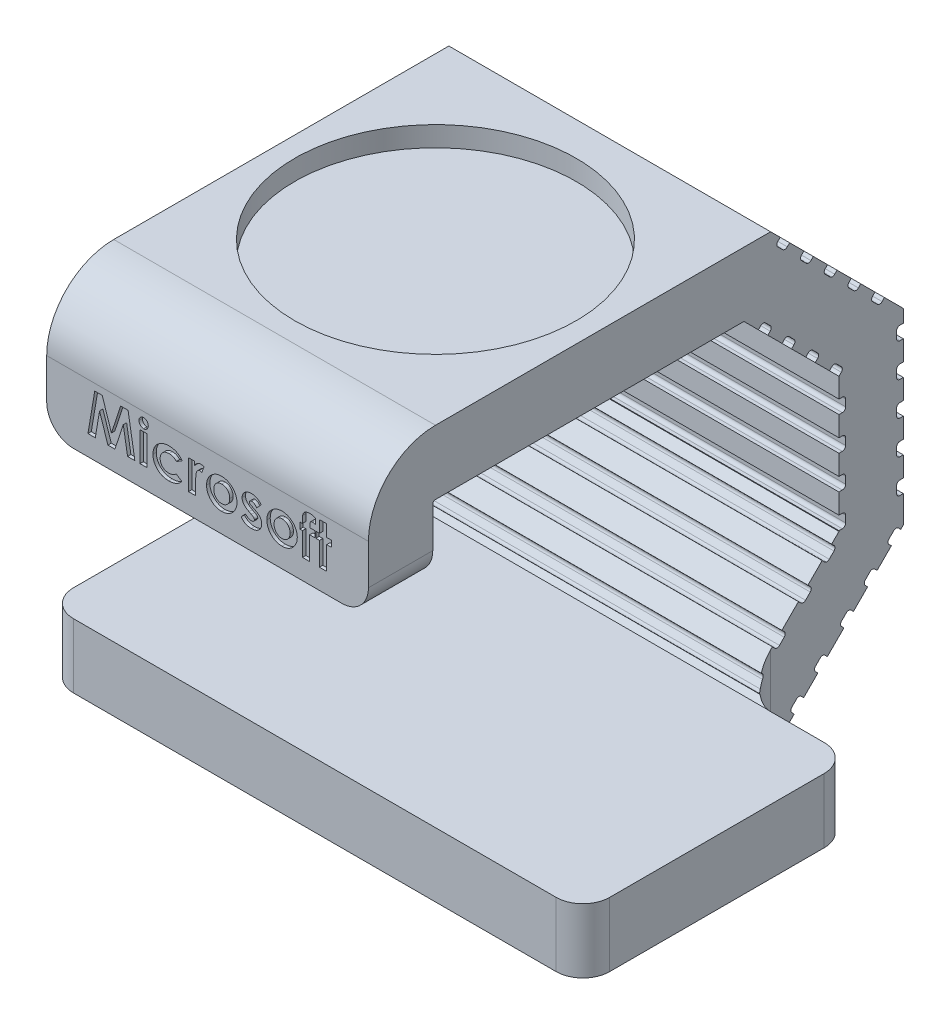
from build123d import *

# Parameters (mm, degrees)
ESTRUSIONE_ESTRUSIONE1_DEPTH  = 24
ESTRUSIONE_ESTRUSIONE2_DEPTH  = 4.8
RACCORDO1_R                   = 2
SCHIZZO3_R                    = 10.5
TAGLIO_ESTRUSIONE1_DEPTH      = 1.5
RACCORDO2_R                   = 2
TAGLIO_ESTRUSIONE2_DEPTH      = 57.426496379
TAGLIO_ESTRUSIONE2_DEPTH_BACK = 57.426496379
AVVOLGI1_START                = -0.25
AVVOLGI1_OUTLINE_W            = 0.538461538
AVVOLGI1_OUTLINE_H            = 2.192307693
AVVOLGI1_DEPTH                = 0.25


# Read off the part's stored shape, not the designer's step: Avvolgi1
with BuildPart() as part:
    # Schizzo1 → Estrusione-Estrusione1 (new body)
    with BuildSketch(Plane(origin=(0, 0, 0), x_dir=(0, 0, -1), z_dir=(1, 0, 0))):
        with BuildLine():
            Line((0, 0), (22, 0))
            Line((22, 0), (31.899494937, 9.899494937))
            Line((31.899494937, 9.899494937), (31.899494937, 23.899494937))
            Line((31.899494937, 23.899494937), (22, 33.798989873))
            Line((22, 33.798989873), (-3, 33.798989873))
            ThreePointArc((-3, 33.798989873), (-6.535533906, 32.334523779), (-8, 28.798989873))
            Line((-8, 28.798989873), (-8, 23.798989873))
            Line((-8, 23.798989873), (-3.2, 23.798989873))
            Line((-3.2, 23.798989873), (-3.2, 28.798989873))
            ThreePointArc((-3.2, 28.798989873), (-3.141421356, 28.940411229), (-3, 28.998989873))
            Line((-3, 28.998989873), (20.011774901, 28.998989873))
            Line((20.011774901, 28.998989873), (27.099494937, 21.911269837))
            Line((27.099494937, 21.911269837), (27.099494937, 11.887720036))
            Line((27.099494937, 11.887720036), (20.011774901, 4.8))
            Line((20.011774901, 4.8), (0, 4.8))
            Line((0, 4.8), (0, 0))
        make_face()
    extrude(amount=ESTRUSIONE_ESTRUSIONE1_DEPTH)

    # Schizzo2 → Estrusione-Estrusione2 (add)
    with BuildSketch(Plane.XZ):
        with BuildLine():
            Line((30, 0), (-6, 0))
            ThreePointArc((-6, 0), (-7.414213562, -0.585786438), (-8, -2))
            Line((-8, -2), (-8, -18))
            ThreePointArc((-8, -18), (-7.414213562, -19.414213562), (-6, -20))
            Line((-6, -20), (30, -20))
            ThreePointArc((30, -20), (31.414213562, -19.414213562), (32, -18))
            Line((32, -18), (32, -2))
            ThreePointArc((32, -2), (31.414213562, -0.585786438), (30, 0))
        make_face()
    extrude(amount=-ESTRUSIONE_ESTRUSIONE2_DEPTH)

    # Raccordo1
    # the kernel refuses this fillet: 2 mm, written as the material it adds along each edge
    with BuildSketch(Plane(origin=(24, 0, -20), x_dir=(0, 0, -1), z_dir=(0, 1, 0))) as raccordo1_piece_1_section:
        with BuildLine():
            CenterArc((RACCORDO1_R, -RACCORDO1_R), RACCORDO1_R, 90, 90)
            Line((0, -RACCORDO1_R), (0, 0))
            Line((0, 0), (RACCORDO1_R, 0))
        make_face()
    raccordo1_piece_1 = extrude(amount=4.8, mode=Mode.PRIVATE)
    raccordo1_piece_1 = split(raccordo1_piece_1, bisect_by=Plane(origin=(24.452498062, 3.819976411, -19.031751312), z_dir=(0, -0.7071067811865431, -0.707106781186552)), keep=Keep.TOP, mode=Mode.PRIVATE)
    add(raccordo1_piece_1)
    with BuildSketch(Plane(origin=(24, 0, -20), x_dir=(0, 0, -1), z_dir=(0, 1, 0))) as raccordo1_piece_2_section:
        with BuildLine():
            CenterArc((RACCORDO1_R, -RACCORDO1_R), RACCORDO1_R, 90, 90)
            Line((0, -RACCORDO1_R), (0, 0))
            Line((0, 0), (RACCORDO1_R, 0))
        make_face()
    raccordo1_piece_2 = extrude(amount=4.8, mode=Mode.PRIVATE)
    raccordo1_piece_2 = split(raccordo1_piece_2, bisect_by=Plane(origin=(24.977199086, 4.77405125, -19.98582615), z_dir=(0, 0.7071067811865431, 0.707106781186552)), keep=Keep.TOP, mode=Mode.PRIVATE)
    add(raccordo1_piece_2)
    with BuildSketch(Plane(origin=(24, 0, -20), x_dir=(0, 0, -1), z_dir=(0, 1, 0))) as raccordo1_piece_3_section:
        with BuildLine():
            CenterArc((RACCORDO1_R, -RACCORDO1_R), RACCORDO1_R, 90, 90)
            Line((0, -RACCORDO1_R), (0, 0))
            Line((0, 0), (RACCORDO1_R, 0))
        make_face()
    raccordo1_piece_3 = extrude(amount=9.8, mode=Mode.PRIVATE)
    raccordo1_piece_3 = split(raccordo1_piece_3, bisect_by=Plane(origin=(24.208417606, 4.8, -20.868927937), z_dir=(0, 1, 0)), keep=Keep.TOP, mode=Mode.PRIVATE)
    raccordo1_piece_3 = split(raccordo1_piece_3, bisect_by=Plane(origin=(24.208417606, 5.442864777, -20.654639678), z_dir=(0, -0.7071067811865431, -0.707106781186552)), keep=Keep.TOP, mode=Mode.PRIVATE)
    add(raccordo1_piece_3)
    with BuildSketch(Plane(origin=(0, 0, -20), x_dir=(-1, 0, 0), z_dir=(0, 1, 0))) as raccordo1_piece_4_section:
        with BuildLine():
            CenterArc((RACCORDO1_R, -RACCORDO1_R), RACCORDO1_R, 90, 90)
            Line((0, -RACCORDO1_R), (0, 0))
            Line((0, 0), (RACCORDO1_R, 0))
        make_face()
    raccordo1_piece_4 = extrude(amount=4.8, mode=Mode.PRIVATE)
    raccordo1_piece_4 = split(raccordo1_piece_4, bisect_by=Plane(origin=(-0.452498062, 3.819976411, -19.031751312), z_dir=(0, -0.7071067811865431, -0.707106781186552)), keep=Keep.TOP, mode=Mode.PRIVATE)
    add(raccordo1_piece_4)
    with BuildSketch(Plane(origin=(0, 0, -20), x_dir=(-1, 0, 0), z_dir=(0, 1, 0))) as raccordo1_piece_5_section:
        with BuildLine():
            CenterArc((RACCORDO1_R, -RACCORDO1_R), RACCORDO1_R, 90, 90)
            Line((0, -RACCORDO1_R), (0, 0))
            Line((0, 0), (RACCORDO1_R, 0))
        make_face()
    raccordo1_piece_5 = extrude(amount=9.8, mode=Mode.PRIVATE)
    raccordo1_piece_5 = split(raccordo1_piece_5, bisect_by=Plane(origin=(-0.208417604, 4.8, -20.868927937), z_dir=(0, 1, 0)), keep=Keep.TOP, mode=Mode.PRIVATE)
    raccordo1_piece_5 = split(raccordo1_piece_5, bisect_by=Plane(origin=(-0.208417604, 5.442864778, -20.654639678), z_dir=(0, -0.7071067811865431, -0.707106781186552)), keep=Keep.TOP, mode=Mode.PRIVATE)
    add(raccordo1_piece_5)
    with BuildSketch(Plane(origin=(0, 0, -20), x_dir=(-1, 0, 0), z_dir=(0, 1, 0))) as raccordo1_piece_6_section:
        with BuildLine():
            CenterArc((RACCORDO1_R, -RACCORDO1_R), RACCORDO1_R, 90, 90)
            Line((0, -RACCORDO1_R), (0, 0))
            Line((0, 0), (RACCORDO1_R, 0))
        make_face()
    raccordo1_piece_6 = extrude(amount=4.8, mode=Mode.PRIVATE)
    raccordo1_piece_6 = split(raccordo1_piece_6, bisect_by=Plane(origin=(-0.977199088, 4.77405125, -19.98582615), z_dir=(0, 0.7071067811865431, 0.707106781186552)), keep=Keep.TOP, mode=Mode.PRIVATE)
    add(raccordo1_piece_6)

    # Schizzo3 → Taglio-Estrusione1 (cut)
    with BuildSketch(Plane(origin=(0, 33.798989873, 0), x_dir=(1, 0, 0), z_dir=(0, 1, 0))):
        with Locations(Location((12, 9, 0), (0, 0, 270))):
            Circle(SCHIZZO3_R)
    extrude(amount=-TAGLIO_ESTRUSIONE1_DEPTH, mode=Mode.SUBTRACT)

    # Raccordo2
    raccordo2_edges = [part.edges().sort_by_distance(p)[0] for p in [
        (0, 23.798989873, 5.6),
        (24, 23.798989873, 5.6),
    ]]
    fillet(raccordo2_edges, radius=RACCORDO2_R)

    # Schizzo4 → Taglio-Estrusione2 (cut, two sides: drawn at the far end of the back side and taken through both)
    with BuildSketch(Plane(origin=(24, 0, 0), x_dir=(0, 0, -1), z_dir=(1, 0, 0)).offset(-TAGLIO_ESTRUSIONE2_DEPTH_BACK)):
        with BuildLine():
            Line((21.072435072, 5.860660172), (20.365328291, 5.153553391))
            Line((20.365328291, 5.153553391), (20.542104986, 4.976776695))
            ThreePointArc((20.542104986, 4.976776695), (20.718881682, 4.903553391), (20.895658377, 4.976776695))
            Line((20.895658377, 4.976776695), (21.249211768, 5.330330086))
            ThreePointArc((21.249211768, 5.330330086), (21.322435072, 5.507106781), (21.249211768, 5.683883476))
            Line((21.249211768, 5.683883476), (21.072435072, 5.860660172))
        make_face()
        with BuildLine():
            Line((26.552512627, 11.340737726), (25.845405845, 10.633630945))
            Line((25.845405845, 10.633630945), (26.022182541, 10.456854249))
            ThreePointArc((26.022182541, 10.456854249), (26.198959236, 10.383630945), (26.375735931, 10.456854249))
            Line((26.375735931, 10.456854249), (26.729289322, 10.81040764))
            ThreePointArc((26.729289322, 10.81040764), (26.802512627, 10.987184335), (26.729289322, 11.163961031))
            Line((26.729289322, 11.163961031), (26.552512627, 11.340737726))
        make_face()
        with BuildLine():
            Line((24.784745674, 9.572970773), (24.077638892, 8.865863992))
            Line((24.077638892, 8.865863992), (24.254415588, 8.689087297))
            ThreePointArc((24.254415588, 8.689087297), (24.431192283, 8.615863992), (24.607968978, 8.689087297))
            Line((24.607968978, 8.689087297), (24.961522369, 9.042640687))
            ThreePointArc((24.961522369, 9.042640687), (25.034745674, 9.219417382), (24.961522369, 9.396194078))
            Line((24.961522369, 9.396194078), (24.784745674, 9.572970773))
        make_face()
        with BuildLine():
            Line((22.840202025, 7.628427125), (22.133095244, 6.921320344))
            Line((22.133095244, 6.921320344), (22.309871939, 6.744543648))
            ThreePointArc((22.309871939, 6.744543648), (22.486648635, 6.671320344), (22.66342533, 6.744543648))
            Line((22.66342533, 6.744543648), (23.016978721, 7.098097039))
            ThreePointArc((23.016978721, 7.098097039), (23.090202025, 7.274873734), (23.016978721, 7.451650429))
            Line((23.016978721, 7.451650429), (22.840202025, 7.628427125))
        make_face()
        with BuildLine():
            Line((24.624621202, 24.386143571), (25.331727984, 23.67903679))
            Line((25.331727984, 23.67903679), (25.508504679, 23.855813485))
            ThreePointArc((25.508504679, 23.855813485), (25.581727984, 24.032590181), (25.508504679, 24.209366876))
            Line((25.508504679, 24.209366876), (25.154951288, 24.562920267))
            ThreePointArc((25.154951288, 24.562920267), (24.978174593, 24.636143571), (24.801397898, 24.562920267))
            Line((24.801397898, 24.562920267), (24.624621202, 24.386143571))
        make_face()
        with BuildLine():
            Line((23.759440841, 1.759440841), (24.466547622, 2.466547622))
            Line((24.466547622, 2.466547622), (24.289770927, 2.643324317))
            ThreePointArc((24.289770927, 2.643324317), (24.112994231, 2.716547622), (23.936217536, 2.643324317))
            Line((23.936217536, 2.643324317), (23.582664146, 2.289770927))
            ThreePointArc((23.582664146, 2.289770927), (23.509440841, 2.112994231), (23.582664146, 1.936217536))
            Line((23.582664146, 1.936217536), (23.759440841, 1.759440841))
        make_face()
        with BuildLine():
            Line((25.527207794, 3.527207794), (26.234314575, 4.234314575))
            Line((26.234314575, 4.234314575), (26.05753788, 4.41109127))
            ThreePointArc((26.05753788, 4.41109127), (25.880761184, 4.484314575), (25.703984489, 4.41109127))
            Line((25.703984489, 4.41109127), (25.350431099, 4.05753788))
            ThreePointArc((25.350431099, 4.05753788), (25.277207794, 3.880761184), (25.350431099, 3.703984489))
            Line((25.350431099, 3.703984489), (25.527207794, 3.527207794))
        make_face()
        with BuildLine():
            ThreePointArc((28.002081528, 6.355634919), (27.825304833, 6.428858223), (27.648528137, 6.355634919))
            Line((27.648528137, 6.355634919), (27.294974747, 6.002081528))
            ThreePointArc((27.294974747, 6.002081528), (27.221751442, 5.825304833), (27.294974747, 5.648528137))
            Line((27.294974747, 5.648528137), (27.471751442, 5.471751442))
            Line((27.471751442, 5.471751442), (28.178858223, 6.178858223))
            Line((28.178858223, 6.178858223), (28.002081528, 6.355634919))
        make_face()
        with BuildLine():
            Line((31.007285348, 9.007285348), (31.714392129, 9.714392129))
            Line((31.714392129, 9.714392129), (31.537615434, 9.891168825))
            ThreePointArc((31.537615434, 9.891168825), (31.360838739, 9.964392129), (31.184062043, 9.891168825))
            Line((31.184062043, 9.891168825), (30.830508653, 9.537615434))
            ThreePointArc((30.830508653, 9.537615434), (30.757285348, 9.360838739), (30.830508653, 9.184062043))
            Line((30.830508653, 9.184062043), (31.007285348, 9.007285348))
        make_face()
        with BuildLine():
            Line((21.991673888, -0.008326112), (22.698780669, 0.698780669))
            Line((22.698780669, 0.698780669), (22.522003974, 0.875557364))
            ThreePointArc((22.522003974, 0.875557364), (22.345227279, 0.948780669), (22.168450583, 0.875557364))
            Line((22.168450583, 0.875557364), (21.814897193, 0.522003974))
            ThreePointArc((21.814897193, 0.522003974), (21.741673888, 0.345227279), (21.814897193, 0.168450583))
            Line((21.814897193, 0.168450583), (21.991673888, -0.008326112))
        make_face()
        with BuildLine():
            Line((29.239518395, 7.239518395), (29.946625176, 7.946625176))
            Line((29.946625176, 7.946625176), (29.769848481, 8.123401872))
            ThreePointArc((29.769848481, 8.123401872), (29.593071786, 8.196625176), (29.41629509, 8.123401872))
            Line((29.41629509, 8.123401872), (29.0627417, 7.769848481))
            ThreePointArc((29.0627417, 7.769848481), (28.989518395, 7.593071786), (29.0627417, 7.41629509))
            Line((29.0627417, 7.41629509), (29.239518395, 7.239518395))
        make_face()
        with BuildLine():
            Line((27.099494937, 12.937720036), (27.099494937, 11.937720036))
            Line((27.099494937, 11.937720036), (27.349494937, 11.937720036))
            ThreePointArc((27.349494937, 11.937720036), (27.526271632, 12.010943341), (27.599494937, 12.187720036))
            Line((27.599494937, 12.187720036), (27.599494937, 12.687720036))
            ThreePointArc((27.599494937, 12.687720036), (27.526271632, 12.864496731), (27.349494937, 12.937720036))
            Line((27.349494937, 12.937720036), (27.099494937, 12.937720036))
        make_face()
        with BuildLine():
            Line((27.349494937, 15.437720036), (27.099494937, 15.437720036))
            Line((27.099494937, 15.437720036), (27.099494937, 14.437720036))
            Line((27.099494937, 14.437720036), (27.349494937, 14.437720036))
            ThreePointArc((27.349494937, 14.437720036), (27.526271632, 14.510943341), (27.599494937, 14.687720036))
            Line((27.599494937, 14.687720036), (27.599494937, 15.187720036))
            ThreePointArc((27.599494937, 15.187720036), (27.526271632, 15.364496731), (27.349494937, 15.437720036))
        make_face()
        with BuildLine():
            Line((27.349494937, 17.937720036), (27.099494937, 17.937720036))
            Line((27.099494937, 17.937720036), (27.099494937, 16.937720036))
            Line((27.099494937, 16.937720036), (27.349494937, 16.937720036))
            ThreePointArc((27.349494937, 16.937720036), (27.526271632, 17.010943341), (27.599494937, 17.187720036))
            Line((27.599494937, 17.187720036), (27.599494937, 17.687720036))
            ThreePointArc((27.599494937, 17.687720036), (27.526271632, 17.864496731), (27.349494937, 17.937720036))
        make_face()
        with BuildLine():
            Line((27.349494937, 20.437720036), (27.099494937, 20.437720036))
            Line((27.099494937, 20.437720036), (27.099494937, 19.437720036))
            Line((27.099494937, 19.437720036), (27.349494937, 19.437720036))
            ThreePointArc((27.349494937, 19.437720036), (27.526271632, 19.510943341), (27.599494937, 19.687720036))
            Line((27.599494937, 19.687720036), (27.599494937, 20.187720036))
            ThreePointArc((27.599494937, 20.187720036), (27.526271632, 20.364496731), (27.349494937, 20.437720036))
        make_face()
        with BuildLine():
            Line((31.649494937, 19.437720036), (31.899494937, 19.437720036))
            Line((31.899494937, 19.437720036), (31.899494937, 20.437720036))
            Line((31.899494937, 20.437720036), (31.649494937, 20.437720036))
            ThreePointArc((31.649494937, 20.437720036), (31.472718241, 20.364496731), (31.399494937, 20.187720036))
            Line((31.399494937, 20.187720036), (31.399494937, 19.687720036))
            ThreePointArc((31.399494937, 19.687720036), (31.472718241, 19.510943341), (31.649494937, 19.437720036))
        make_face()
        with BuildLine():
            Line((31.649494937, 16.937720036), (31.899494937, 16.937720036))
            Line((31.899494937, 16.937720036), (31.899494937, 17.937720036))
            Line((31.899494937, 17.937720036), (31.649494937, 17.937720036))
            ThreePointArc((31.649494937, 17.937720036), (31.472718241, 17.864496731), (31.399494937, 17.687720036))
            Line((31.399494937, 17.687720036), (31.399494937, 17.187720036))
            ThreePointArc((31.399494937, 17.187720036), (31.472718241, 17.010943341), (31.649494937, 16.937720036))
        make_face()
        with BuildLine():
            Line((31.649494937, 14.437720036), (31.899494937, 14.437720036))
            Line((31.899494937, 14.437720036), (31.899494937, 15.437720036))
            Line((31.899494937, 15.437720036), (31.649494937, 15.437720036))
            ThreePointArc((31.649494937, 15.437720036), (31.472718241, 15.364496731), (31.399494937, 15.187720036))
            Line((31.399494937, 15.187720036), (31.399494937, 14.687720036))
            ThreePointArc((31.399494937, 14.687720036), (31.472718241, 14.510943341), (31.649494937, 14.437720036))
        make_face()
        with BuildLine():
            Line((26.392388155, 22.618376618), (27.099494937, 21.911269837))
            Line((27.099494937, 21.911269837), (27.276271632, 22.088046533))
            ThreePointArc((27.276271632, 22.088046533), (27.349494937, 22.264823228), (27.276271632, 22.441599923))
            Line((27.276271632, 22.441599923), (26.922718241, 22.795153314))
            ThreePointArc((26.922718241, 22.795153314), (26.745941546, 22.868376618), (26.569164851, 22.795153314))
            Line((26.569164851, 22.795153314), (26.392388155, 22.618376618))
        make_face()
        with BuildLine():
            Line((31.899494937, 11.937720036), (31.899494937, 12.937720036))
            Line((31.899494937, 12.937720036), (31.649494937, 12.937720036))
            ThreePointArc((31.649494937, 12.937720036), (31.472718241, 12.864496731), (31.399494937, 12.687720036))
            Line((31.399494937, 12.687720036), (31.399494937, 12.187720036))
            ThreePointArc((31.399494937, 12.187720036), (31.472718241, 12.010943341), (31.649494937, 11.937720036))
            Line((31.649494937, 11.937720036), (31.899494937, 11.937720036))
        make_face()
        with BuildLine():
            Line((22.856854249, 26.153910524), (23.563961031, 25.446803743))
            Line((23.563961031, 25.446803743), (23.740737726, 25.623580438))
            ThreePointArc((23.740737726, 25.623580438), (23.813961031, 25.800357134), (23.740737726, 25.977133829))
            Line((23.740737726, 25.977133829), (23.387184335, 26.33068722))
            ThreePointArc((23.387184335, 26.33068722), (23.21040764, 26.403910524), (23.033630945, 26.33068722))
            Line((23.033630945, 26.33068722), (22.856854249, 26.153910524))
        make_face()
        with BuildLine():
            Line((21.089087297, 27.921677477), (21.796194078, 27.214570696))
            Line((21.796194078, 27.214570696), (21.972970773, 27.391347391))
            ThreePointArc((21.972970773, 27.391347391), (22.046194078, 27.568124087), (21.972970773, 27.744900782))
            Line((21.972970773, 27.744900782), (21.619417382, 28.098454173))
            ThreePointArc((21.619417382, 28.098454173), (21.442640687, 28.171677477), (21.265863992, 28.098454173))
            Line((21.265863992, 28.098454173), (21.089087297, 27.921677477))
        make_face()
        with BuildLine():
            Line((31.649494937, 21.937720036), (31.899494937, 21.937720036))
            Line((31.899494937, 21.937720036), (31.899494937, 22.937720036))
            Line((31.899494937, 22.937720036), (31.649494937, 22.937720036))
            ThreePointArc((31.649494937, 22.937720036), (31.472718241, 22.864496731), (31.399494937, 22.687720036))
            Line((31.399494937, 22.687720036), (31.399494937, 22.187720036))
            ThreePointArc((31.399494937, 22.187720036), (31.472718241, 22.010943341), (31.649494937, 21.937720036))
        make_face()
        with BuildLine():
            Line((25.190306627, 30.608683246), (24.483199846, 31.315790027))
            Line((24.483199846, 31.315790027), (24.306423151, 31.139013332))
            ThreePointArc((24.306423151, 31.139013332), (24.233199846, 30.962236636), (24.306423151, 30.785459941))
            Line((24.306423151, 30.785459941), (24.659976542, 30.431906551))
            ThreePointArc((24.659976542, 30.431906551), (24.836753237, 30.358683246), (25.013529932, 30.431906551))
            Line((25.013529932, 30.431906551), (25.190306627, 30.608683246))
        make_face()
        with BuildLine():
            Line((26.95807358, 28.840916293), (26.250966799, 29.548023074))
            Line((26.250966799, 29.548023074), (26.074190104, 29.371246379))
            ThreePointArc((26.074190104, 29.371246379), (26.000966799, 29.194469683), (26.074190104, 29.017692988))
            Line((26.074190104, 29.017692988), (26.427743494, 28.664139598))
            ThreePointArc((26.427743494, 28.664139598), (26.60452019, 28.590916293), (26.781296885, 28.664139598))
            Line((26.781296885, 28.664139598), (26.95807358, 28.840916293))
        make_face()
        with BuildLine():
            Line((30.493607486, 25.305382387), (29.786500705, 26.012489168))
            Line((29.786500705, 26.012489168), (29.60972401, 25.835712473))
            ThreePointArc((29.60972401, 25.835712473), (29.536500705, 25.658935778), (29.60972401, 25.482159082))
            Line((29.60972401, 25.482159082), (29.9632774, 25.128605692))
            ThreePointArc((29.9632774, 25.128605692), (30.140054096, 25.055382387), (30.316830791, 25.128605692))
            Line((30.316830791, 25.128605692), (30.493607486, 25.305382387))
        make_face()
        with BuildLine():
            Line((28.725840533, 27.07314934), (28.018733752, 27.780256121))
            Line((28.018733752, 27.780256121), (27.841957057, 27.603479426))
            ThreePointArc((27.841957057, 27.603479426), (27.768733752, 27.42670273), (27.841957057, 27.249926035))
            Line((27.841957057, 27.249926035), (28.195510447, 26.896372645))
            ThreePointArc((28.195510447, 26.896372645), (28.372287143, 26.82314934), (28.549063838, 26.896372645))
            Line((28.549063838, 26.896372645), (28.725840533, 27.07314934))
        make_face()
        with BuildLine():
            Line((23.422539674, 32.376450199), (22.715432893, 33.08355698))
            Line((22.715432893, 33.08355698), (22.538656198, 32.906780285))
            ThreePointArc((22.538656198, 32.906780285), (22.465432893, 32.730003589), (22.538656198, 32.553226894))
            Line((22.538656198, 32.553226894), (22.892209589, 32.199673503))
            ThreePointArc((22.892209589, 32.199673503), (23.068986284, 32.126450199), (23.245762979, 32.199673503))
            Line((23.245762979, 32.199673503), (23.422539674, 32.376450199))
        make_face()
    extrude(amount=TAGLIO_ESTRUSIONE2_DEPTH + TAGLIO_ESTRUSIONE2_DEPTH_BACK, mode=Mode.SUBTRACT)

    # Avvolgi1 outline → Avvolgi1 (cut)
    # profile 1 of 10: a face of its own
    with BuildSketch(Plane.XY.offset(8).offset(AVVOLGI1_START)):
        with BuildLine():
            add(Edge.make_bspline(
                [(7.576923077, 28.047186989), (7.575639697, 28.022822853), (7.573138971, 27.975348176), (7.553805601, 27.906771391), (7.521496365, 27.844055857), (7.477083774, 27.788843312), (7.424687713, 27.742667572), (7.366077689, 27.707840468), (7.30141733, 27.687258213), (7.256553914, 27.684835444), (7.233774038, 27.683605258)],
                knots=[0, 0, 0, 0, 0.13162057, 0.256468948, 0.381954886, 0.51070434, 0.637377053, 0.757775202, 0.877007784, 1, 1, 1, 1], degree=3))
            add(Edge.make_bspline(
                [(7.229567308, 28.414374489), (7.252774996, 28.413235832), (7.298345529, 28.410999969), (7.363631517, 28.38920528), (7.423550824, 28.354999168), (7.476521153, 28.308067566), (7.520576919, 28.25202265), (7.554237161, 28.18927664), (7.572987879, 28.119756082), (7.575592076, 28.071732007), (7.576923077, 28.047186989)],
                knots=[0, 0, 0, 0, 0.123733577, 0.242962799, 0.363854564, 0.490606197, 0.618739544, 0.743300131, 0.868801156, 1, 1, 1, 1], degree=3))
            add(Edge.make_bspline(
                [(6.884615385, 28.054999489), (6.885948473, 28.078949906), (6.888567134, 28.125997044), (6.907430171, 28.193971957), (6.940318584, 28.255663108), (6.984057013, 28.31068207), (7.036562083, 28.35673822), (7.09644542, 28.389905471), (7.161292032, 28.410799977), (7.206573891, 28.413170682), (7.229567308, 28.414374489)],
                knots=[0, 0, 0, 0, 0.129827096, 0.255026588, 0.378937478, 0.506522648, 0.634371171, 0.754975888, 0.875580604, 1, 1, 1, 1], degree=3))
            add(Edge.make_bspline(
                [(7.233774038, 27.683605258), (7.210363766, 27.684739844), (7.164396772, 27.68696765), (7.098575303, 27.708813333), (7.037856827, 27.74275005), (6.985116283, 27.790640537), (6.94055598, 27.847083695), (6.908366031, 27.911290486), (6.888230421, 27.981286425), (6.885840342, 28.030021768), (6.884615385, 28.054999489)],
                knots=[0, 0, 0, 0, 0.123633166, 0.242758603, 0.363442651, 0.489711254, 0.617482185, 0.742279995, 0.867913967, 1, 1, 1, 1], degree=3))
        make_face()
    # profile 2 of 10: a face of its own
    with BuildSketch(Plane.XY.offset(8).offset(AVVOLGI1_START)):
        with BuildLine():
            add(Edge.make_bspline(
                [(9.669471154, 26.798989873), (9.649032106, 26.819457779), (9.609743117, 26.858802239), (9.546740067, 26.908606084), (9.484862798, 26.949842283), (9.421560367, 26.980272479), (9.356266925, 27.003189333), (9.286627418, 27.018367669), (9.21182903, 27.028362064), (9.160090899, 27.029283823), (9.133413462, 27.029759104)],
                knots=[0, 0, 0, 0, 0.143845607, 0.27650742, 0.399013508, 0.513165303, 0.625101201, 0.742650755, 0.867304473, 1, 1, 1, 1], degree=3))
            Line((9.669471154, 26.798989873), (10.115384615, 27.044182181))
            add(Edge.make_bspline(
                [(9.131009615, 27.529759104), (9.15726271, 27.52946229), (9.209039365, 27.528876911), (9.285501779, 27.522755959), (9.359878454, 27.512359252), (9.432295966, 27.498604847), (9.502974244, 27.481560744), (9.570966013, 27.458841526), (9.637200834, 27.433056069), (9.722511984, 27.394122721), (9.823078215, 27.336008397), (9.933472993, 27.252659646), (10.031903302, 27.155153764), (10.087409607, 27.081369317), (10.115384615, 27.044182181)],
                knots=[0, 0, 0, 0, 0.068894834, 0.135875182, 0.201160501, 0.265918632, 0.329296018, 0.391812639, 0.453909987, 0.515786581, 0.637804213, 0.757893318, 0.87797897, 1, 1, 1, 1], degree=3))
            add(Edge.make_bspline(
                [(7.923076923, 26.387331219), (7.923523306, 26.413190744), (7.924407455, 26.464410511), (7.931955285, 26.540477577), (7.943697171, 26.615253815), (7.961343841, 26.688214336), (7.98304613, 26.759713116), (8.009428201, 26.829735785), (8.04153066, 26.897921012), (8.07734105, 26.964848823), (8.118154922, 27.028752422), (8.162682009, 27.089603605), (8.210859578, 27.147029687), (8.263253592, 27.200495472), (8.319498728, 27.250383529), (8.378777326, 27.297705995), (8.443007614, 27.340022341), (8.509956698, 27.379807523), (8.580201276, 27.415223997), (8.652933983, 27.445793083), (8.727592757, 27.471765931), (8.804356551, 27.492648625), (8.88289588, 27.509859793), (8.963909605, 27.520782708), (9.046727473, 27.52846019), (9.102746191, 27.529323522), (9.131009615, 27.529759104)],
                knots=[0, 0, 0, 0, 0.041780147, 0.082753626, 0.123413874, 0.164008346, 0.203945665, 0.244108014, 0.284805616, 0.325652295, 0.366693494, 0.407225963, 0.447431342, 0.487721344, 0.528073722, 0.568874194, 0.610175022, 0.65225882, 0.694677458, 0.737184942, 0.779671465, 0.822316784, 0.865682179, 0.909494751, 0.954336902, 1, 1, 1, 1], degree=3))
            add(Edge.make_bspline(
                [(9.114783654, 25.260528335), (9.069467399, 25.261575912), (8.980959756, 25.263621946), (8.851962065, 25.279290707), (8.730633039, 25.305682602), (8.616723085, 25.342335519), (8.510336055, 25.389814771), (8.411816972, 25.448706785), (8.320501327, 25.517373398), (8.238036821, 25.59613899), (8.164459559, 25.681876186), (8.100226345, 25.772171086), (8.044674523, 25.865405867), (8.001094173, 25.963132387), (7.965477016, 26.063827412), (7.941422306, 26.168694607), (7.925556743, 26.276870168), (7.923910183, 26.350214512), (7.923076923, 26.387331219)],
                knots=[0, 0, 0, 0, 0.073961065, 0.144454116, 0.211737939, 0.276369484, 0.339453786, 0.401479123, 0.463348243, 0.525568944, 0.587248521, 0.647499501, 0.706274444, 0.764080805, 0.821889941, 0.880346551, 0.939448064, 1, 1, 1, 1], degree=3))
            add(Edge.make_bspline(
                [(10.076923077, 25.70403795), (10.047930663, 25.668591058), (9.990716338, 25.598639311), (9.890893208, 25.508474063), (9.783453368, 25.43100208), (9.666235972, 25.369164925), (9.540948094, 25.319981374), (9.406610727, 25.285213486), (9.263451095, 25.264747112), (9.165131579, 25.261957072), (9.114783654, 25.260528335)],
                knots=[0, 0, 0, 0, 0.124734545, 0.246154138, 0.365612315, 0.485126693, 0.606563492, 0.731916229, 0.862718389, 1, 1, 1, 1], degree=3))
            Line((10.076923077, 25.70403795), (9.658653846, 25.991297566))
            add(Edge.make_bspline(
                [(9.103966346, 25.760528335), (9.132846774, 25.761189203), (9.189217172, 25.762479123), (9.271163372, 25.773419806), (9.348273624, 25.791511848), (9.420556107, 25.816552672), (9.487909696, 25.849294015), (9.55016133, 25.889285124), (9.607950955, 25.936230988), (9.641650681, 25.972831042), (9.658653846, 25.991297566)],
                knots=[0, 0, 0, 0, 0.139546672, 0.272374826, 0.398724725, 0.521823788, 0.641340891, 0.759786424, 0.878800461, 1, 1, 1, 1], degree=3))
            add(Edge.make_bspline(
                [(8.461538462, 26.384326412), (8.462189246, 26.361868682), (8.463459948, 26.318018373), (8.471266716, 26.25359182), (8.484819558, 26.192260491), (8.505140271, 26.134348626), (8.529496917, 26.079322361), (8.560084406, 26.02761933), (8.596053608, 25.979013758), (8.637593885, 25.933928101), (8.683609972, 25.893379083), (8.733218921, 25.857570103), (8.786272721, 25.827210712), (8.843389394, 25.803385413), (8.903637711, 25.783972779), (8.967420013, 25.770150224), (9.034668425, 25.76247775), (9.080509965, 25.761188185), (9.103966346, 25.760528335)],
                knots=[0, 0, 0, 0, 0.066909768, 0.130646062, 0.193049546, 0.253634274, 0.313202194, 0.372057276, 0.432217215, 0.493039582, 0.554348992, 0.614639045, 0.675044192, 0.736012789, 0.79867544, 0.86340984, 0.930109003, 1, 1, 1, 1], degree=3))
            add(Edge.make_bspline(
                [(9.133413462, 27.029759104), (9.10894841, 27.029168183), (9.061072356, 27.028011799), (8.991117843, 27.019374408), (8.924633247, 27.005808361), (8.861737911, 26.985961185), (8.802543858, 26.959741986), (8.74656158, 26.928715509), (8.694335075, 26.891669899), (8.646602581, 26.849131753), (8.603515616, 26.802298196), (8.565079844, 26.752348195), (8.53359187, 26.698540753), (8.506368564, 26.642140541), (8.486353657, 26.582088235), (8.471710265, 26.518928749), (8.463363667, 26.452659285), (8.462154393, 26.407385919), (8.461538462, 26.384326412)],
                knots=[0, 0, 0, 0, 0.070110342, 0.137200061, 0.201727185, 0.264377395, 0.325826769, 0.387007287, 0.447548571, 0.508965744, 0.569916802, 0.629748696, 0.689226879, 0.748301815, 0.808949201, 0.870234712, 0.933905432, 1, 1, 1, 1], degree=3))
        make_face()
    # profile 3 of 10: a face of its own
    with BuildSketch(Plane.XY.offset(8).offset(AVVOLGI1_START)):
        with BuildLine():
            add(Edge.make_bspline(
                [(11.038461538, 27.221465835), (11.051517576, 27.245445855), (11.077036142, 27.292315799), (11.123915888, 27.355229417), (11.177773239, 27.408213512), (11.236672933, 27.452376292), (11.300793485, 27.486796843), (11.368417861, 27.511325825), (11.438967533, 27.527266264), (11.487094128, 27.528922174), (11.511418269, 27.529759104)],
                knots=[0, 0, 0, 0, 0.137332659, 0.268422379, 0.39320538, 0.516430377, 0.637792883, 0.758061252, 0.877719333, 1, 1, 1, 1], degree=3))
            Line((11.038461538, 27.221465835), (11.038461538, 27.491297566))
            Line((11.038461538, 27.491297566), (10.576923077, 27.491297566))
            Line((10.576923077, 27.491297566), (10.576923077, 25.298989873))
            Line((10.576923077, 25.298989873), (11.115384615, 25.298989873))
            Line((11.115384615, 25.298989873), (11.115384615, 26.186610066))
            Line((11.115384615, 26.186610066), (11.113581731, 26.293581219))
            add(Edge.make_bspline(
                [(11.408653846, 27.068220642), (11.398396603, 27.067773308), (11.378218838, 27.066893323), (11.348437021, 27.059352156), (11.320388752, 27.046347647), (11.292722385, 27.02968758), (11.26762049, 27.006528841), (11.2425341, 26.979718488), (11.22042663, 26.946617542), (11.197096838, 26.909774508), (11.177232354, 26.864678668), (11.160199171, 26.810843527), (11.145022468, 26.747646177), (11.134578824, 26.674751071), (11.124484623, 26.592863594), (11.118476307, 26.501382702), (11.113998232, 26.400597668), (11.113724428, 26.330246076), (11.113581731, 26.293581219)],
                knots=[0, 0, 0, 0, 0.034014511, 0.066912404, 0.101140702, 0.136380892, 0.173597996, 0.214075626, 0.25797978, 0.305417223, 0.358684712, 0.420923911, 0.492691001, 0.574130849, 0.665182153, 0.766512664, 0.878314341, 1, 1, 1, 1], degree=3))
            add(Edge.make_bspline(
                [(11.563701923, 27.019542758), (11.548768491, 27.02675787), (11.520699389, 27.040319503), (11.479947925, 27.056323628), (11.442964283, 27.066088562), (11.419517332, 27.067545576), (11.408653846, 27.068220642)],
                knots=[0, 0, 0, 0, 0.30359675, 0.570645018, 0.80107043, 1, 1, 1, 1], degree=3))
            Line((11.563701923, 27.019542758), (11.730769231, 27.475672566))
            add(Edge.make_bspline(
                [(11.511418269, 27.529759104), (11.529080631, 27.528932042), (11.565047505, 27.527247849), (11.619866083, 27.51745761), (11.675475597, 27.499754995), (11.712071449, 27.483816143), (11.730769231, 27.475672566)],
                knots=[0, 0, 0, 0, 0.232851034, 0.474167851, 0.731338546, 1, 1, 1, 1], degree=3))
        make_face()
    # profile 4 of 10: a face of its own
    with BuildSketch(Plane.XY.offset(8).offset(AVVOLGI1_START)):
        with BuildLine():
            add(Edge.make_bspline(
                [(14.192307692, 26.396946604), (14.191846633, 26.371690109), (14.190929944, 26.321474472), (14.183536224, 26.246775474), (14.171304505, 26.173403348), (14.1554664, 26.100925846), (14.133442423, 26.030270387), (14.107709756, 25.960395482), (14.076121895, 25.892253551), (14.041199187, 25.82510123), (14.001245902, 25.760914608), (13.958405891, 25.699496679), (13.910927197, 25.642458723), (13.861422977, 25.588031836), (13.807545132, 25.53805649), (13.750153653, 25.49172122), (13.689745392, 25.448459556), (13.625885949, 25.409286498), (13.559393256, 25.374866529), (13.491388702, 25.343834118), (13.421474633, 25.31799742), (13.34979574, 25.296928304), (13.276308551, 25.280615015), (13.201175309, 25.269533204), (13.124557822, 25.261825932), (13.072935975, 25.260963652), (13.046875, 25.260528335)],
                knots=[0, 0, 0, 0, 0.04216776, 0.083839067, 0.125192329, 0.166335368, 0.207601958, 0.248670144, 0.290582404, 0.332926248, 0.374978427, 0.416740924, 0.457856759, 0.498808992, 0.539515963, 0.580420356, 0.621910028, 0.663502052, 0.705394285, 0.746863727, 0.788245389, 0.82973641, 0.871532383, 0.913824669, 0.956494908, 1, 1, 1, 1], degree=3))
            add(Edge.make_bspline(
                [(13.044471154, 27.529759104), (13.069928576, 27.529306072), (13.120345807, 27.528408863), (13.195435974, 27.520940416), (13.269213392, 27.508755337), (13.342102123, 27.492977788), (13.413425328, 27.47087108), (13.483557088, 27.444357503), (13.55312447, 27.413916817), (13.620400826, 27.377681752), (13.685872177, 27.338381519), (13.747942913, 27.295030138), (13.806097582, 27.247968119), (13.86141573, 27.198286631), (13.911319444, 27.143822705), (13.958997838, 27.087200642), (14.001874965, 27.02639187), (14.041573007, 26.962878158), (14.076915889, 26.897026795), (14.107604682, 26.829295864), (14.134239669, 26.760621795), (14.155094331, 26.69016809), (14.172360068, 26.618863775), (14.183255975, 26.545835069), (14.19100221, 26.47183216), (14.191870808, 26.422007312), (14.192307692, 26.396946604)],
                knots=[0, 0, 0, 0, 0.042598506, 0.084364343, 0.126142289, 0.167705805, 0.209066008, 0.25097289, 0.293148456, 0.336041456, 0.37876116, 0.420892731, 0.462622223, 0.503914433, 0.545187585, 0.586138136, 0.627721928, 0.669584534, 0.711432369, 0.752690541, 0.793970501, 0.834591739, 0.875576584, 0.916639513, 0.958071667, 1, 1, 1, 1], degree=3))
            add(Edge.make_bspline(
                [(12.295072115, 27.235888912), (12.322267861, 27.259496717), (12.375919438, 27.306070029), (12.463085593, 27.36514064), (12.552333899, 27.416159626), (12.644734037, 27.458106722), (12.740543593, 27.489734156), (12.839271599, 27.512756098), (12.940897525, 27.526896849), (13.009771161, 27.52880017), (13.044471154, 27.529759104)],
                knots=[0, 0, 0, 0, 0.131014441, 0.25846437, 0.382579777, 0.504990606, 0.627227493, 0.749296729, 0.873690397, 1, 1, 1, 1], degree=3))
            add(Edge.make_bspline(
                [(11.923076923, 26.393340835), (11.924227442, 26.43467149), (11.926488765, 26.515906065), (11.94444466, 26.634916569), (11.973118289, 26.748863486), (12.014277476, 26.857428071), (12.066854718, 26.960810557), (12.131039614, 27.058792898), (12.207149371, 27.151397289), (12.265434204, 27.207407599), (12.295072115, 27.235888912)],
                knots=[0, 0, 0, 0, 0.130489087, 0.256473689, 0.3792365, 0.500977689, 0.622366534, 0.744855131, 0.870258513, 1, 1, 1, 1], degree=3))
            add(Edge.make_bspline(
                [(13.046875, 25.260528335), (13.00876854, 25.261646835), (12.933660126, 25.263851415), (12.82304319, 25.278952211), (12.71677683, 25.304944641), (12.614687887, 25.341177515), (12.516643743, 25.387608594), (12.42350005, 25.445074104), (12.334330282, 25.512442715), (12.250678926, 25.589145021), (12.174042952, 25.673294396), (12.107092209, 25.763123342), (12.05024561, 25.857285473), (12.003554299, 25.955888165), (11.967518129, 26.059066631), (11.941493866, 26.166512401), (11.926374607, 26.278527491), (11.924188672, 26.354633775), (11.923076923, 26.393340835)],
                knots=[0, 0, 0, 0, 0.064374939, 0.126883986, 0.188200706, 0.248894086, 0.309598788, 0.371125298, 0.433465539, 0.498143129, 0.562592753, 0.625474489, 0.687114454, 0.748124994, 0.809456656, 0.871431117, 0.934610872, 1, 1, 1, 1], degree=3))
        make_face()
        with BuildLine():
            add(Edge.make_bspline(
                [(12.461538462, 26.398148527), (12.46193278, 26.374888398), (12.4627034, 26.329430942), (12.470683334, 26.263056943), (12.483842506, 26.200068458), (12.502537567, 26.140562791), (12.526049762, 26.084112817), (12.554896499, 26.031035258), (12.589382223, 25.98164925), (12.628480664, 25.936015608), (12.671291786, 25.894593446), (12.718200867, 25.859046496), (12.767243532, 25.828160915), (12.819549988, 25.803355026), (12.874377335, 25.784202867), (12.931888332, 25.770101777), (12.992385199, 25.762504793), (13.033634502, 25.761196213), (13.0546875, 25.760528335)],
                knots=[0, 0, 0, 0, 0.071358163, 0.139455827, 0.204809025, 0.268587499, 0.330586987, 0.392213478, 0.453609543, 0.515091734, 0.576401551, 0.636039465, 0.695407414, 0.753980593, 0.813284842, 0.873377339, 0.935373778, 1, 1, 1, 1], degree=3))
            add(Edge.make_bspline(
                [(13.056490385, 27.029759104), (13.035642631, 27.029066194), (12.994603605, 27.027702192), (12.93419308, 27.020381962), (12.877056169, 27.00537852), (12.822058027, 26.986298249), (12.770171576, 26.960781074), (12.719975832, 26.930920099), (12.674080861, 26.893552764), (12.630265661, 26.85256353), (12.590491226, 26.807046087), (12.556599631, 26.757454866), (12.526316739, 26.705687125), (12.503354758, 26.649847581), (12.484351524, 26.591462491), (12.471490363, 26.52958853), (12.462539893, 26.464916863), (12.461875447, 26.420616329), (12.461538462, 26.398148527)],
                knots=[0, 0, 0, 0, 0.064415632, 0.126802865, 0.187422712, 0.246517508, 0.306285303, 0.365703059, 0.4264774, 0.488621826, 0.550895458, 0.612678531, 0.673914015, 0.735734248, 0.798735035, 0.86329015, 0.930665176, 1, 1, 1, 1], degree=3))
            add(Edge.make_bspline(
                [(13.653846154, 26.398148527), (13.653446819, 26.421008432), (13.652663194, 26.465866982), (13.644682692, 26.531435605), (13.63165266, 26.59366765), (13.612716474, 26.652297393), (13.589344032, 26.707993704), (13.560477357, 26.760471497), (13.52582156, 26.809472304), (13.486533051, 26.854753152), (13.443080163, 26.895594067), (13.396985537, 26.932014249), (13.347195129, 26.962136537), (13.294643039, 26.986968056), (13.23918945, 27.006072364), (13.180896618, 27.020253369), (13.119585894, 27.027742251), (13.077742029, 27.029079794), (13.056490385, 27.029759104)],
                knots=[0, 0, 0, 0, 0.070243401, 0.137840339, 0.202697511, 0.265405501, 0.326938422, 0.388125269, 0.449116585, 0.511100798, 0.572085896, 0.632197341, 0.691338952, 0.750563856, 0.810545842, 0.871334761, 0.934653553, 1, 1, 1, 1], degree=3))
            add(Edge.make_bspline(
                [(13.0546875, 25.760528335), (13.075751027, 25.761120713), (13.117047769, 25.762282118), (13.177615678, 25.770979206), (13.235420369, 25.784666708), (13.290715984, 25.803983703), (13.343055454, 25.829320549), (13.392639138, 25.860353891), (13.439903232, 25.896395266), (13.483288884, 25.938598986), (13.523450152, 25.984374943), (13.558669182, 26.034021657), (13.588099532, 26.087099229), (13.612237689, 26.143273695), (13.630969398, 26.202467844), (13.643910718, 26.264901694), (13.652865974, 26.330381756), (13.653515392, 26.37528063), (13.653846154, 26.398148527)],
                knots=[0, 0, 0, 0, 0.064469005, 0.126396675, 0.18693923, 0.24609921, 0.305348133, 0.364571657, 0.424924428, 0.486952233, 0.549550456, 0.611149272, 0.672921868, 0.735010283, 0.798048595, 0.862642915, 0.93004128, 1, 1, 1, 1], degree=3))
        make_face(mode=Mode.SUBTRACT)
    # profile 5 of 10: a face of its own
    with BuildSketch(Plane.XY.offset(8).offset(AVVOLGI1_START)):
        with BuildLine():
            add(Edge.make_bspline(
                [(15.670673077, 26.798989873), (15.654228206, 26.817187015), (15.622775397, 26.851991253), (15.574624187, 26.899437208), (15.527190042, 26.938945673), (15.481356894, 26.97213443), (15.436188667, 26.99758624), (15.39206081, 27.015898247), (15.34895215, 27.027522981), (15.320377908, 27.029027759), (15.306490385, 27.029759104)],
                knots=[0, 0, 0, 0, 0.165955823, 0.317410625, 0.456950276, 0.58332669, 0.699846294, 0.806829432, 0.906116121, 1, 1, 1, 1], degree=3))
            Line((15.670673077, 26.798989873), (16, 27.152956219))
            add(Edge.make_bspline(
                [(15.284254808, 27.529759104), (15.319184868, 27.528609062), (15.388514878, 27.526326432), (15.490763005, 27.507855378), (15.589524091, 27.476809798), (15.684521261, 27.434034181), (15.774532555, 27.380277387), (15.857578581, 27.314998483), (15.934221366, 27.239804932), (15.977856057, 27.182193265), (16, 27.152956219)],
                knots=[0, 0, 0, 0, 0.124573754, 0.247256927, 0.369332697, 0.493143367, 0.618175595, 0.742424943, 0.869284569, 1, 1, 1, 1], degree=3))
            add(Edge.make_bspline(
                [(14.576923077, 26.916177373), (14.577412588, 26.937053644), (14.578373579, 26.978037155), (14.588603899, 27.038224281), (14.604059719, 27.09607941), (14.625869544, 27.151694421), (14.65380755, 27.205124498), (14.688036454, 27.256132524), (14.728973846, 27.304625765), (14.775309148, 27.350448014), (14.826719619, 27.39218031), (14.881736384, 27.429164882), (14.940196715, 27.46066886), (15.002580386, 27.485786073), (15.068094468, 27.505777811), (15.137171423, 27.519366768), (15.209516538, 27.528009393), (15.258989059, 27.529167603), (15.284254808, 27.529759104)],
                knots=[0, 0, 0, 0, 0.059939729, 0.117671426, 0.174927578, 0.231800431, 0.288963898, 0.347880323, 0.407952601, 0.471049184, 0.534884649, 0.597952338, 0.661310995, 0.725346023, 0.790907706, 0.857857422, 0.927407405, 1, 1, 1, 1], degree=3))
            add(Edge.make_bspline(
                [(15.090144231, 26.261730258), (15.049656577, 26.283441358), (14.971935461, 26.325118529), (14.866885567, 26.396586021), (14.777975997, 26.472664588), (14.705134298, 26.552945511), (14.647093887, 26.637203501), (14.606606807, 26.726511329), (14.581136736, 26.820022335), (14.57833462, 26.883966176), (14.576923077, 26.916177373)],
                knots=[0, 0, 0, 0, 0.156999966, 0.30138107, 0.433468886, 0.55616084, 0.671090252, 0.781737752, 0.890052141, 1, 1, 1, 1], degree=3))
            Line((15.090144231, 26.261730258), (15.268629808, 26.171586027))
            add(Edge.make_bspline(
                [(15.5, 25.929398527), (15.499276362, 25.939706113), (15.497790594, 25.960869573), (15.486027722, 25.992108354), (15.467559781, 26.02303976), (15.441945754, 26.053751), (15.408844815, 26.083992889), (15.368375423, 26.1135232), (15.321471208, 26.14391741), (15.286825085, 26.162058684), (15.268629808, 26.171586027)],
                knots=[0, 0, 0, 0, 0.088083321, 0.180852038, 0.282344706, 0.395671014, 0.521905478, 0.665304482, 0.82422628, 1, 1, 1, 1], degree=3))
            add(Edge.make_bspline(
                [(15.266826923, 25.760528335), (15.283503267, 25.761011293), (15.315559802, 25.761939672), (15.361120438, 25.771596632), (15.40150293, 25.78783141), (15.435748786, 25.810341341), (15.464233573, 25.836179304), (15.484304216, 25.8655443), (15.497575988, 25.896682373), (15.499189016, 25.918452928), (15.5, 25.929398527)],
                knots=[0, 0, 0, 0, 0.156876484, 0.301559898, 0.436095937, 0.564305413, 0.685771608, 0.795668418, 0.897268056, 1, 1, 1, 1], degree=3))
            add(Edge.make_bspline(
                [(14.826322115, 25.991297566), (14.842221631, 25.974527665), (14.873787369, 25.941233929), (14.926994448, 25.897331636), (14.983291306, 25.857317926), (15.043304661, 25.823719465), (15.103330142, 25.79659022), (15.16091964, 25.776239491), (15.214987814, 25.763450432), (15.250141548, 25.761468866), (15.266826923, 25.760528335)],
                knots=[0, 0, 0, 0, 0.13598274, 0.269970212, 0.405476151, 0.542300739, 0.674310235, 0.792959344, 0.901730181, 1, 1, 1, 1], degree=3))
            Line((14.826322115, 25.991297566), (14.5, 25.628917758))
            add(Edge.make_bspline(
                [(15.257211538, 25.260528335), (15.218693393, 25.261754924), (15.143085666, 25.26416261), (15.032666053, 25.280934207), (14.928400625, 25.309966124), (14.830203599, 25.350636126), (14.737473532, 25.402460858), (14.651534715, 25.466764005), (14.570897318, 25.541870201), (14.523981642, 25.599473155), (14.5, 25.628917758)],
                knots=[0, 0, 0, 0, 0.132112657, 0.259325514, 0.382032301, 0.502496341, 0.623101408, 0.745416994, 0.869866125, 1, 1, 1, 1], degree=3))
            add(Edge.make_bspline(
                [(16.038461538, 25.929398527), (16.037689094, 25.905932872), (16.036177215, 25.860004358), (16.026619434, 25.792401963), (16.009451184, 25.728122096), (15.986857793, 25.66616276), (15.956425173, 25.607644369), (15.919478481, 25.552283246), (15.876601119, 25.499352531), (15.826659562, 25.450662879), (15.771949422, 25.405284657), (15.711129869, 25.367118313), (15.646890078, 25.333561324), (15.577532937, 25.307356304), (15.504031612, 25.286110995), (15.425756045, 25.271388528), (15.342971842, 25.262123303), (15.286283721, 25.261069018), (15.257211538, 25.260528335)],
                knots=[0, 0, 0, 0, 0.061037547, 0.119466677, 0.177091205, 0.233801698, 0.290657991, 0.348169354, 0.406675088, 0.467463083, 0.52930472, 0.591161718, 0.653842612, 0.717507486, 0.783633932, 0.85260547, 0.924409548, 1, 1, 1, 1], degree=3))
            add(Edge.make_bspline(
                [(15.501201923, 26.617499489), (15.525972954, 26.604921564), (15.574033406, 26.580518027), (15.6416019, 26.541139644), (15.704009238, 26.502971287), (15.760003548, 26.463853876), (15.80992755, 26.424467013), (15.853426637, 26.384421211), (15.89155588, 26.344986001), (15.934075339, 26.292114164), (15.976607559, 26.22169318), (16.012066221, 26.130113971), (16.034677778, 26.032052774), (16.037179486, 25.964180881), (16.038461538, 25.929398527)],
                knots=[0, 0, 0, 0, 0.089724459, 0.174082305, 0.252553485, 0.325976874, 0.394597931, 0.457802993, 0.516846181, 0.571621607, 0.67671862, 0.781023735, 0.887781089, 1, 1, 1, 1], degree=3))
            Line((15.501201923, 26.617499489), (15.306490385, 26.716057181))
            add(Edge.make_bspline(
                [(15.115384615, 26.895744681), (15.116950908, 26.881616983), (15.120200783, 26.852303651), (15.142522916, 26.81830456), (15.17205671, 26.793224126), (15.206100636, 26.769885342), (15.252204924, 26.743790083), (15.287180807, 26.725921896), (15.306490385, 26.716057181)],
                knots=[0, 0, 0, 0, 0.152783617, 0.317008256, 0.424889083, 0.573382242, 0.764471748, 1, 1, 1, 1], degree=3))
            add(Edge.make_bspline(
                [(15.306490385, 27.029759104), (15.292437606, 27.029330823), (15.265530908, 27.028510799), (15.227559526, 27.02147705), (15.194199128, 27.009300334), (15.165970322, 26.992702335), (15.1432908, 26.972255305), (15.127411809, 26.948864384), (15.11674892, 26.923257087), (15.115846909, 26.905067234), (15.115384615, 26.895744681)],
                knots=[0, 0, 0, 0, 0.161883531, 0.309956602, 0.442911393, 0.569224986, 0.685243533, 0.791551218, 0.893167089, 1, 1, 1, 1], degree=3))
        make_face()
    # profile 6 of 10: a face of its own
    with BuildSketch(Plane.XY.offset(8).offset(AVVOLGI1_START)):
        with BuildLine():
            add(Edge.make_bspline(
                [(18.692307692, 26.396946604), (18.691846633, 26.371690109), (18.690929944, 26.321474472), (18.683536224, 26.246775474), (18.671304505, 26.173403348), (18.6554664, 26.100925846), (18.633442423, 26.030270387), (18.607709756, 25.960395482), (18.576121895, 25.892253551), (18.541199187, 25.82510123), (18.501245902, 25.760914608), (18.458405891, 25.699496679), (18.410927197, 25.642458723), (18.361422977, 25.588031836), (18.307545132, 25.53805649), (18.250153653, 25.49172122), (18.189745392, 25.448459556), (18.125885949, 25.409286498), (18.059393256, 25.374866529), (17.991388702, 25.343834118), (17.921474633, 25.31799742), (17.84979574, 25.296928304), (17.776308551, 25.280615015), (17.701175309, 25.269533204), (17.624557822, 25.261825932), (17.572935975, 25.260963652), (17.546875, 25.260528335)],
                knots=[0, 0, 0, 0, 0.04216776, 0.083839067, 0.125192329, 0.166335368, 0.207601958, 0.248670144, 0.290582404, 0.332926248, 0.374978427, 0.416740924, 0.457856759, 0.498808992, 0.539515963, 0.580420356, 0.621910028, 0.663502052, 0.705394285, 0.746863727, 0.788245389, 0.82973641, 0.871532383, 0.913824669, 0.956494908, 1, 1, 1, 1], degree=3))
            add(Edge.make_bspline(
                [(17.544471154, 27.529759104), (17.569928576, 27.529306072), (17.620345807, 27.528408863), (17.695435974, 27.520940416), (17.769213392, 27.508755337), (17.842102123, 27.492977788), (17.913425328, 27.47087108), (17.983557088, 27.444357503), (18.05312447, 27.413916817), (18.120400826, 27.377681752), (18.185872177, 27.338381519), (18.247942913, 27.295030138), (18.306097582, 27.247968119), (18.36141573, 27.198286631), (18.411319444, 27.143822705), (18.458997838, 27.087200642), (18.501874965, 27.02639187), (18.541573007, 26.962878158), (18.576915889, 26.897026795), (18.607604682, 26.829295864), (18.634239669, 26.760621795), (18.655094331, 26.69016809), (18.672360068, 26.618863775), (18.683255975, 26.545835069), (18.69100221, 26.47183216), (18.691870808, 26.422007312), (18.692307692, 26.396946604)],
                knots=[0, 0, 0, 0, 0.042598506, 0.084364343, 0.126142289, 0.167705805, 0.209066008, 0.25097289, 0.293148456, 0.336041456, 0.37876116, 0.420892731, 0.462622223, 0.503914433, 0.545187585, 0.586138136, 0.627721928, 0.669584534, 0.711432369, 0.752690541, 0.793970501, 0.834591739, 0.875576584, 0.916639513, 0.958071667, 1, 1, 1, 1], degree=3))
            add(Edge.make_bspline(
                [(16.795072115, 27.235888912), (16.822267861, 27.259496717), (16.875919438, 27.306070029), (16.963085593, 27.36514064), (17.052333899, 27.416159626), (17.144734037, 27.458106722), (17.240543593, 27.489734156), (17.339271599, 27.512756098), (17.440897525, 27.526896849), (17.509771161, 27.52880017), (17.544471154, 27.529759104)],
                knots=[0, 0, 0, 0, 0.131014441, 0.25846437, 0.382579777, 0.504990606, 0.627227493, 0.749296729, 0.873690397, 1, 1, 1, 1], degree=3))
            add(Edge.make_bspline(
                [(16.423076923, 26.393340835), (16.424227442, 26.43467149), (16.426488765, 26.515906065), (16.44444466, 26.634916569), (16.473118289, 26.748863486), (16.514277476, 26.857428071), (16.566854718, 26.960810557), (16.631039614, 27.058792898), (16.707149371, 27.151397289), (16.765434204, 27.207407599), (16.795072115, 27.235888912)],
                knots=[0, 0, 0, 0, 0.130489087, 0.256473689, 0.3792365, 0.500977689, 0.622366534, 0.744855131, 0.870258513, 1, 1, 1, 1], degree=3))
            add(Edge.make_bspline(
                [(17.546875, 25.260528335), (17.50876854, 25.261646835), (17.433660126, 25.263851415), (17.32304319, 25.278952211), (17.21677683, 25.304944641), (17.114687887, 25.341177515), (17.016643743, 25.387608594), (16.92350005, 25.445074104), (16.834330282, 25.512442715), (16.750678926, 25.589145021), (16.674042952, 25.673294396), (16.607092209, 25.763123342), (16.55024561, 25.857285473), (16.503554299, 25.955888165), (16.467518129, 26.059066631), (16.441493866, 26.166512401), (16.426374607, 26.278527491), (16.424188672, 26.354633775), (16.423076923, 26.393340835)],
                knots=[0, 0, 0, 0, 0.064374939, 0.126883986, 0.188200706, 0.248894086, 0.309598788, 0.371125298, 0.433465539, 0.498143129, 0.562592753, 0.625474489, 0.687114454, 0.748124994, 0.809456656, 0.871431117, 0.934610872, 1, 1, 1, 1], degree=3))
        make_face()
        with BuildLine():
            add(Edge.make_bspline(
                [(16.961538462, 26.398148527), (16.96193278, 26.374888398), (16.9627034, 26.329430942), (16.970683334, 26.263056943), (16.983842506, 26.200068458), (17.002537567, 26.140562791), (17.026049762, 26.084112817), (17.054896499, 26.031035258), (17.089382223, 25.98164925), (17.128480664, 25.936015608), (17.171291786, 25.894593446), (17.218200867, 25.859046496), (17.267243532, 25.828160915), (17.319549988, 25.803355026), (17.374377335, 25.784202867), (17.431888332, 25.770101777), (17.492385199, 25.762504793), (17.533634502, 25.761196213), (17.5546875, 25.760528335)],
                knots=[0, 0, 0, 0, 0.071358163, 0.139455827, 0.204809025, 0.268587499, 0.330586987, 0.392213478, 0.453609543, 0.515091734, 0.576401551, 0.636039465, 0.695407414, 0.753980593, 0.813284842, 0.873377339, 0.935373778, 1, 1, 1, 1], degree=3))
            add(Edge.make_bspline(
                [(17.556490385, 27.029759104), (17.535642631, 27.029066194), (17.494603605, 27.027702192), (17.43419308, 27.020381962), (17.377056169, 27.00537852), (17.322058027, 26.986298249), (17.270171576, 26.960781074), (17.219975832, 26.930920099), (17.174080861, 26.893552764), (17.130265661, 26.85256353), (17.090491226, 26.807046087), (17.056599631, 26.757454866), (17.026316739, 26.705687125), (17.003354758, 26.649847581), (16.984351524, 26.591462491), (16.971490363, 26.52958853), (16.962539893, 26.464916863), (16.961875447, 26.420616329), (16.961538462, 26.398148527)],
                knots=[0, 0, 0, 0, 0.064415632, 0.126802865, 0.187422712, 0.246517508, 0.306285303, 0.365703059, 0.4264774, 0.488621826, 0.550895458, 0.612678531, 0.673914015, 0.735734248, 0.798735035, 0.86329015, 0.930665176, 1, 1, 1, 1], degree=3))
            add(Edge.make_bspline(
                [(18.153846154, 26.398148527), (18.153446819, 26.421008432), (18.152663194, 26.465866982), (18.144682692, 26.531435605), (18.13165266, 26.59366765), (18.112716474, 26.652297393), (18.089344032, 26.707993704), (18.060477357, 26.760471497), (18.02582156, 26.809472304), (17.986533051, 26.854753152), (17.943080163, 26.895594067), (17.896985537, 26.932014249), (17.847195129, 26.962136537), (17.794643039, 26.986968056), (17.73918945, 27.006072364), (17.680896618, 27.020253369), (17.619585894, 27.027742251), (17.577742029, 27.029079794), (17.556490385, 27.029759104)],
                knots=[0, 0, 0, 0, 0.070243401, 0.137840339, 0.202697511, 0.265405501, 0.326938422, 0.388125269, 0.449116585, 0.511100798, 0.572085896, 0.632197341, 0.691338952, 0.750563856, 0.810545842, 0.871334761, 0.934653553, 1, 1, 1, 1], degree=3))
            add(Edge.make_bspline(
                [(17.5546875, 25.760528335), (17.575751027, 25.761120713), (17.617047769, 25.762282118), (17.677615678, 25.770979206), (17.735420369, 25.784666708), (17.790715984, 25.803983703), (17.843055454, 25.829320549), (17.892639138, 25.860353891), (17.939903232, 25.896395266), (17.983288884, 25.938598986), (18.023450152, 25.984374943), (18.058669182, 26.034021657), (18.088099532, 26.087099229), (18.112237689, 26.143273695), (18.130969398, 26.202467844), (18.143910718, 26.264901694), (18.152865974, 26.330381756), (18.153515392, 26.37528063), (18.153846154, 26.398148527)],
                knots=[0, 0, 0, 0, 0.064469005, 0.126396675, 0.18693923, 0.24609921, 0.305348133, 0.364571657, 0.424924428, 0.486952233, 0.549550456, 0.611149272, 0.672921868, 0.735010283, 0.798048595, 0.862642915, 0.93004128, 1, 1, 1, 1], degree=3))
        make_face(mode=Mode.SUBTRACT)
    # profile 7 of 10: a face of its own
    with BuildSketch(Plane.XY.offset(8).offset(AVVOLGI1_START)):
        with BuildLine():
            add(Edge.make_bspline(
                [(19.076923077, 27.491297566), (19.077051591, 27.526154027), (19.077294595, 27.592062857), (19.078729732, 27.685408095), (19.079697516, 27.767547566), (19.081426191, 27.838468636), (19.083859118, 27.897963565), (19.086353124, 27.9460291), (19.088221302, 27.982968507), (19.090855186, 28.003725846), (19.091947115, 28.012331219)],
                knots=[0, 0, 0, 0, 0.200540395, 0.379194621, 0.537105586, 0.673145943, 0.787337723, 0.87965386, 0.950108077, 1, 1, 1, 1], degree=3))
            Line((19.076923077, 27.491297566), (18.884615385, 27.491297566))
            Line((18.884615385, 27.491297566), (18.884615385, 27.029759104))
            Line((18.884615385, 27.029759104), (19.076923077, 27.029759104))
            Line((19.076923077, 27.029759104), (19.076923077, 25.298989873))
            Line((19.076923077, 25.298989873), (19.615384615, 25.298989873))
            Line((19.615384615, 25.298989873), (19.615384615, 27.029759104))
            Line((19.615384615, 27.029759104), (20, 27.029759104))
            Line((20, 27.029759104), (20, 27.491297566))
            Line((20, 27.491297566), (19.652043269, 27.491297566))
            Line((19.652043269, 27.491297566), (19.653846154, 27.779158142))
            add(Edge.make_bspline(
                [(19.6875, 27.910768719), (19.682333808, 27.904169346), (19.670920002, 27.889589175), (19.660545585, 27.859837388), (19.655278608, 27.822233755), (19.654353183, 27.794405119), (19.653846154, 27.779158142)],
                knots=[0, 0, 0, 0, 0.180276456, 0.398289592, 0.670330064, 1, 1, 1, 1], degree=3))
            add(Edge.make_bspline(
                [(19.834735577, 27.952836027), (19.819061253, 27.95250572), (19.789689987, 27.951886775), (19.748977138, 27.944012591), (19.714118259, 27.931614337), (19.696037401, 27.917454634), (19.6875, 27.910768719)],
                knots=[0, 0, 0, 0, 0.299999302, 0.562152446, 0.79325759, 1, 1, 1, 1], degree=3))
            add(Edge.make_bspline(
                [(20.038461538, 27.916778335), (20.018881409, 27.92219191), (19.981537727, 27.932516809), (19.927806083, 27.943978364), (19.879392243, 27.951055846), (19.848977577, 27.952268288), (19.834735577, 27.952836027)],
                knots=[0, 0, 0, 0, 0.293681303, 0.560115882, 0.794019448, 1, 1, 1, 1], degree=3))
            Line((20.038461538, 27.916778335), (20.038461538, 28.335648527))
            add(Edge.make_bspline(
                [(19.634615385, 28.414374489), (19.665320369, 28.413416293), (19.729272677, 28.411420565), (19.827530195, 28.39528633), (19.931774567, 28.370587429), (20.001956294, 28.347603625), (20.038461538, 28.335648527)],
                knots=[0, 0, 0, 0, 0.222818915, 0.464086991, 0.721243174, 1, 1, 1, 1], degree=3))
            add(Edge.make_bspline(
                [(19.091947115, 28.012331219), (19.097067304, 28.041855171), (19.107048285, 28.099407345), (19.140088554, 28.17962342), (19.188098729, 28.249500804), (19.238992462, 28.298823957), (19.286157905, 28.332495624), (19.325725792, 28.354487795), (19.368748659, 28.373341808), (19.415365512, 28.388125614), (19.465132994, 28.400202093), (19.518588182, 28.408597062), (19.575437803, 28.413223426), (19.614575117, 28.413984686), (19.634615385, 28.414374489)],
                knots=[0, 0, 0, 0, 0.119769123, 0.233470552, 0.344312896, 0.457241494, 0.515356631, 0.576072786, 0.638240444, 0.703203992, 0.771713444, 0.843216856, 0.919719169, 1, 1, 1, 1], degree=3))
        make_face()
    # profile 8 of 10: a face of its own
    with BuildSketch(Plane.XY.offset(8).offset(AVVOLGI1_START)):
        Polygon((5.516225962, 28.298989873), (4.826923077, 26.206441796), (4.142427885, 28.298989873), (3.583533654, 28.298989873), (3.076923077, 25.298989873), (3.622596154, 25.298989873), (3.942307692, 27.193821604), (4.5625, 25.298989873), (5.087740385, 25.298989873), (5.711538462, 27.193821604), (6.031850962, 25.298989873), (6.576923077, 25.298989873), (6.069711538, 28.298989873), align=None)
    # profile 9 of 10: a face of its own
    with BuildSketch(Plane.XY.offset(8).offset(AVVOLGI1_START)):
        with Locations((7.230769231, 26.395143719)):
            Rectangle(AVVOLGI1_OUTLINE_W, AVVOLGI1_OUTLINE_H)
    # profile 10 of 10: a face of its own
    with BuildSketch(Plane.XY.offset(8).offset(AVVOLGI1_START)):
        Polygon((20.346153846, 27.029759104), (20.346153846, 25.298989873), (20.884615385, 25.298989873), (20.884615385, 27.029759104), (21.230769231, 27.029759104), (21.230769231, 27.491297566), (20.884615385, 27.491297566), (20.884615385, 28.37591295), (20.346153846, 28.37591295), (20.346153846, 27.491297566), (20.076923077, 27.491297566), (20.076923077, 27.029759104), align=None)
    extrude(amount=AVVOLGI1_DEPTH, mode=Mode.SUBTRACT)


solid = part.part
